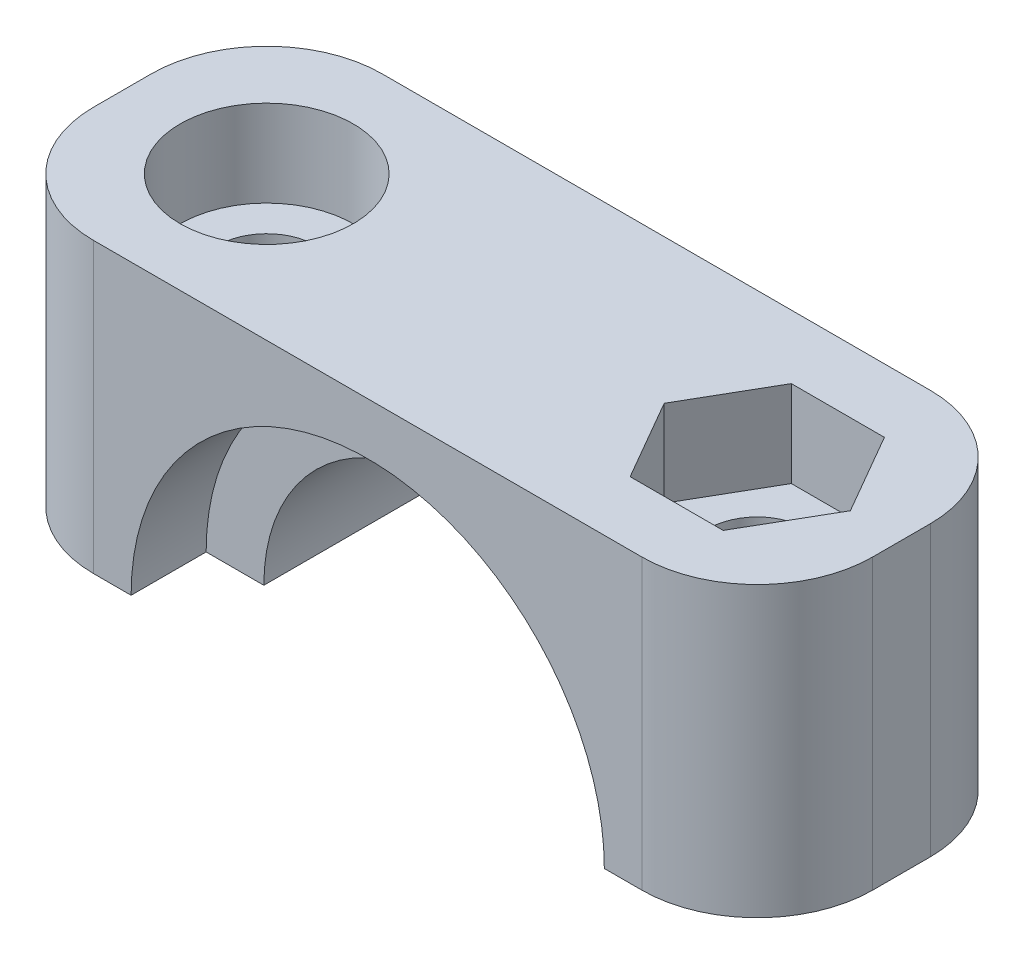
from build123d import *

# Parameters (mm, degrees)
SKETCH1_W           = 27
SKETCH1_H           = 10
BOSS_EXTRUDE1_DEPTH = 10
FILLET1_R           = 4
SKETCH4_R           = 8.2
CUT_EXTRUDE3_DEPTH  = 18.528548143
BOSS_EXTRUDE2_START = 2
BOSS_EXTRUDE2_DEPTH = 5.4
SKETCH2_R           = 1.7
CUT_EXTRUDE1_DEPTH  = 20.551214796
SKETCH3_R           = 3
CUT_EXTRUDE2_DEPTH  = 3


with BuildPart() as part:
    # Sketch1 → Boss-Extrude1 (new body)
    with BuildSketch(Plane.XY):
        Rectangle(SKETCH1_W, SKETCH1_H)
    extrude(amount=BOSS_EXTRUDE1_DEPTH)

    # Fillet1
    fillet1_edges = [part.edges().sort_by_distance(p)[0] for p in [
        (13.5, 0, 0),
        (13.5, 0, 10),
        (-13.5, 0, 0),
        (-13.5, 0, 10),
    ]]
    fillet(fillet1_edges, radius=FILLET1_R)

    # Sketch4 → Cut-Extrude3 (cut, through all)
    with BuildSketch(Plane(origin=(0, 0, 0), x_dir=(-1, 0, 0), z_dir=(0, 0, -1))):
        with Locations((0, -5)):
            Circle(SKETCH4_R)
    extrude(amount=-CUT_EXTRUDE3_DEPTH, mode=Mode.SUBTRACT)

    # Sketch5 → Boss-Extrude2 (add)
    with BuildSketch(Plane.XY.offset(BOSS_EXTRUDE2_START)):
        with BuildLine():
            Line((8.2, -5), (6.2, -5))
            ThreePointArc((6.2, -5), (0, 1.2), (-6.2, -5))
            Line((-6.2, -5), (-8.2, -5))
            ThreePointArc((-8.2, -5), (0, 3.2), (8.2, -5))
        make_face()
    extrude(amount=BOSS_EXTRUDE2_DEPTH)

    # Sketch2 → Cut-Extrude1 (cut, through all)
    with BuildSketch(Plane(origin=(0, 5, 0), x_dir=(1, 0, 0), z_dir=(0, 1, 0))):
        with Locations((-8.5, -5)):
            Circle(SKETCH2_R)
        with Locations((8.5, -5)):
            Circle(SKETCH2_R)
    extrude(amount=-CUT_EXTRUDE1_DEPTH, mode=Mode.SUBTRACT)

    # Sketch3 → Cut-Extrude2 (cut)
    with BuildSketch(Plane(origin=(0, 5, 0), x_dir=(1, 0, 0), z_dir=(0, 1, 0))):
        with Locations((-8.5, -5)):
            Circle(SKETCH3_R)
        Polygon((6.887284606, -7.793305), (10.112715394, -7.793305), (11.725430787, -5), (10.112715394, -2.206695), (6.887284606, -2.206695), (5.274569213, -5), align=None)
    extrude(amount=-CUT_EXTRUDE2_DEPTH, mode=Mode.SUBTRACT)


solid = part.part
